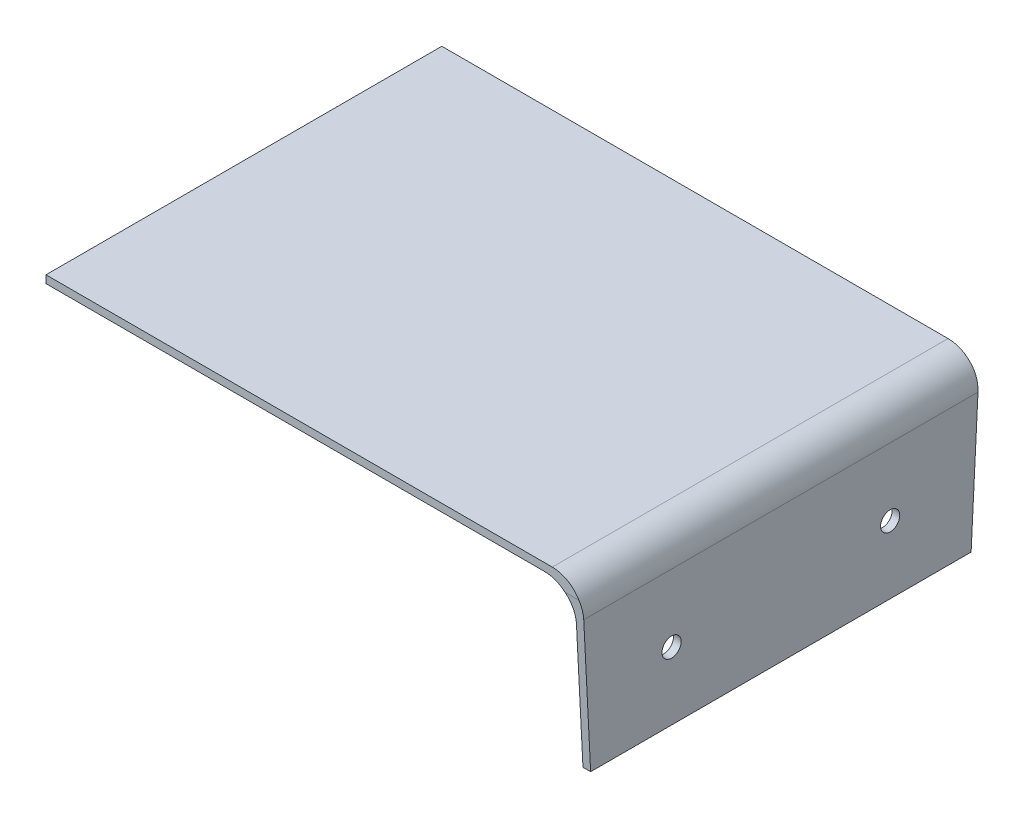
from build123d import *

# Parameters (mm, degrees)
BOSS_EXTRUDE1_DEPTH = 51.6
CUT_EXTRUDE1_DEPTH  = 10
FILLET3_R           = 4
SKETCH4_W           = 5
SKETCH4_H           = 21.6
BOSS_EXTRUDE2_DEPTH = 2.5
SKETCH5_W           = 21.6
SKETCH5_H           = 1.5
BOSS_EXTRUDE3_DEPTH = 2
SKETCH6_R           = 1.25
CUT_EXTRUDE2_DEPTH  = 2


with BuildPart() as part:
    # Sketch1 → Boss-Extrude1 (new body)
    with BuildSketch(Plane.XY):
        Polygon((-22.497058746, 23.5), (-22.497058746, 22.498632165), (42.604598318, 22.498632165), (46.5, 22.498632165), (46.502941254, 18.5), (46.502941254, 1.893175959), (47.502941254, 1.893175959), (47.502941254, 18.5), (47.502941254, 23.5), (42.5, 23.5), align=None)
    extrude(amount=BOSS_EXTRUDE1_DEPTH)

    # Sketch3 → Cut-Extrude1 (cut)
    with BuildSketch(Plane(origin=(47.502941254, 0, 0), x_dir=(0, 0, -1), z_dir=(1, 0, 0))):
        Polygon((-51.6, 21.5), (-51.6, 1.893175959), (-50.6, 1.893175959), align=None)
        Polygon((0, 21.5), (-1, 1.893175959), (0, 1.893175959), align=None)
    extrude(amount=-CUT_EXTRUDE1_DEPTH, mode=Mode.SUBTRACT)

    # Fillet3
    fillet3_edges = [part.edges().sort_by_distance(p)[0] for p in [
        (46.5, 22.498632165, 25.8),
    ]]
    fillet(fillet3_edges, radius=FILLET3_R)
    fillet3_2_edges = [part.edges().sort_by_distance(p)[0] for p in [
        (47.502941254, 23.5, 25.8),
    ]]
    fillet(fillet3_2_edges, radius=FILLET3_R)

    # Sketch4 → Boss-Extrude2 (add)
    with BuildSketch(Plane.XZ.offset(-22.498632165)):
        with Locations((-19.997058746, 25.8)):
            Rectangle(SKETCH4_W, SKETCH4_H)
    extrude(amount=BOSS_EXTRUDE2_DEPTH)

    # Sketch5 → Boss-Extrude3 (add)
    with BuildSketch(Plane.ZY.offset(22.497058746)):
        with Locations((25.8, 20.748632165)):
            Rectangle(SKETCH5_W, SKETCH5_H)
    extrude(amount=BOSS_EXTRUDE3_DEPTH)

    # Sketch6 → Cut-Extrude2 (cut)
    with BuildSketch(Plane(origin=(47.502941254, 0, 0), x_dir=(0, 0, -1), z_dir=(1, 0, 0))):
        with Locations((-40.048997349, 10.696587979)):
            Circle(SKETCH6_R)
        with Locations((-11.551002651, 10.696587979)):
            Circle(SKETCH6_R)
    extrude(amount=-CUT_EXTRUDE2_DEPTH, mode=Mode.SUBTRACT)


solid = part.part
